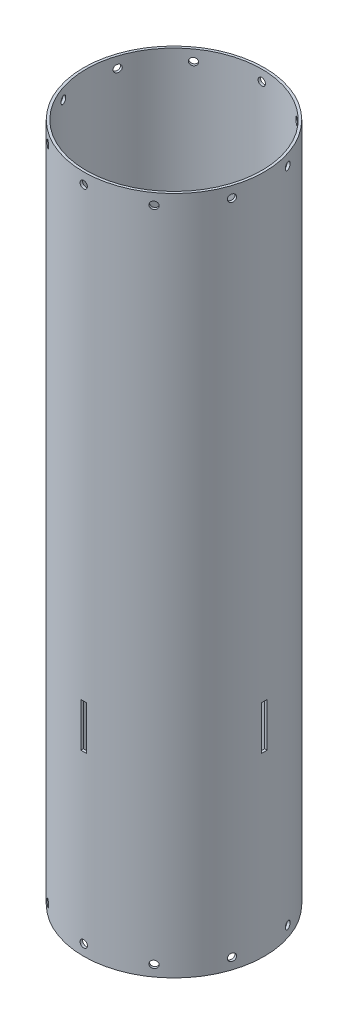
from build123d import *

# Parameters (mm, degrees)
SKETCH1_R           = 78.359
SKETCH1_R_2         = 76.2
BOSS_EXTRUDE1_DEPTH = 589.28
SKETCH2_R           = 3.175
CUT_EXTRUDE1_DEPTH  = 600.60919286
CIRPATTERN1_COUNT   = 10
SKETCH3_W           = 5.08
SKETCH3_H           = 38.1
CUT_EXTRUDE2_DEPTH  = 600.609192984
CIRPATTERN2_COUNT   = 4


with BuildPart() as part:
    # Sketch1 → Boss-Extrude1 (new body)
    with BuildSketch(Plane(origin=(0, 0, 0), x_dir=(1, 0, 0), z_dir=(0, 1, 0))):
        Circle(SKETCH1_R)
        Circle(SKETCH1_R_2, mode=Mode.SUBTRACT)
    extrude(amount=BOSS_EXTRUDE1_DEPTH)

    # Sketch2 → Cut-Extrude1 (cut, through all)
    with BuildSketch(Plane.XY):
        with Locations((0, 9.525)):
            Circle(SKETCH2_R)
        with Locations((0, 579.755)):
            Circle(SKETCH2_R)
    cut_extrude1 = extrude(amount=-CUT_EXTRUDE1_DEPTH, mode=Mode.SUBTRACT)

    # CirPattern1: Cut-Extrude1 ×10 about axis
    cirpattern1_axis = Axis((0, 0, 0), (0, 1, 0))
    for i in range(1, CIRPATTERN1_COUNT):
        add(cut_extrude1.rotate(cirpattern1_axis, i * 360 / CIRPATTERN1_COUNT), mode=Mode.SUBTRACT)

    # Sketch3 → Cut-Extrude2 (cut, through all)
    with BuildSketch(Plane.XY):
        with Locations((0, 172.72)):
            Rectangle(SKETCH3_W, SKETCH3_H)
    cut_extrude2 = extrude(amount=-CUT_EXTRUDE2_DEPTH, mode=Mode.SUBTRACT)

    # CirPattern2: Cut-Extrude2 ×4 about axis
    cirpattern2_axis = Axis((0, 589.28, 0), (0, -1, 0))
    for i in range(1, CIRPATTERN2_COUNT):
        add(cut_extrude2.rotate(cirpattern2_axis, i * 360 / CIRPATTERN2_COUNT), mode=Mode.SUBTRACT)


solid = part.part
